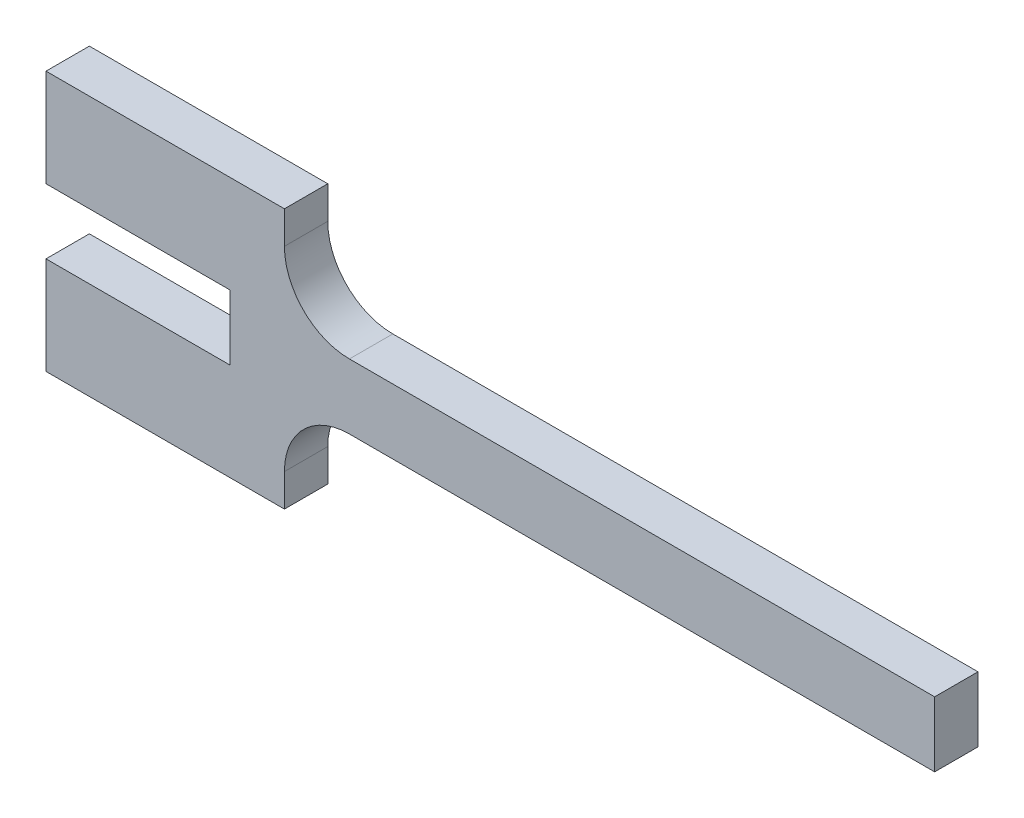
from build123d import *

# Parameters (mm, degrees)
BOSS_EXTRUDE1_DEPTH = 2


with BuildPart() as part:
    # Sketch1 → Boss-Extrude1 (new body)
    with BuildSketch(Plane.XY):
        with BuildLine():
            Line((0, 0), (0, 4.5))
            Line((0, 4.5), (8.5, 4.5))
            Line((8.5, 4.5), (8.5, 7.5))
            Line((8.5, 7.5), (0, 7.5))
            Line((0, 7.5), (0, 12))
            Line((0, 12), (11, 12))
            Line((11, 12), (11, 10.5))
            ThreePointArc((11, 10.5), (11.878679656, 8.378679656), (14, 7.5))
            Line((14, 7.5), (41, 7.5))
            Line((41, 7.5), (41, 4.5))
            Line((41, 4.5), (14, 4.5))
            ThreePointArc((14, 4.5), (11.878679656, 3.621320344), (11, 1.5))
            Line((11, 1.5), (11, 0))
            Line((11, 0), (0, 0))
        make_face()
    extrude(amount=BOSS_EXTRUDE1_DEPTH)


solid = part.part
